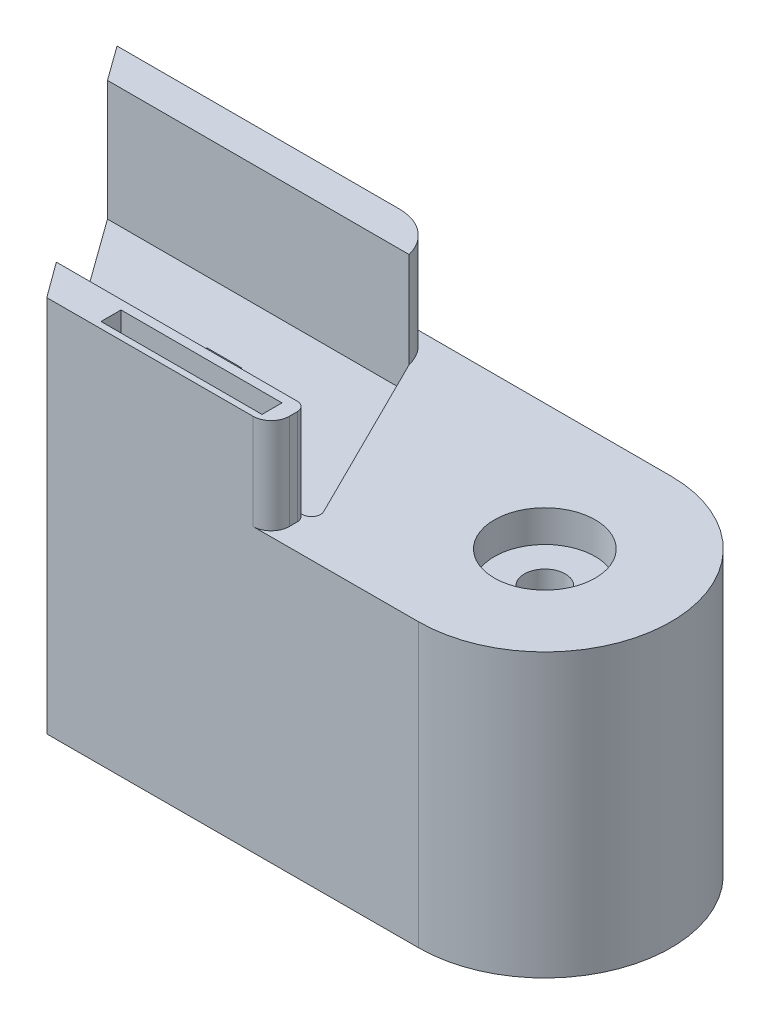
from build123d import *

# Parameters (mm, degrees)
EXTRUDE_1_DEPTH      = 83.1
SKETCH_2_W           = 35.4
SKETCH_2_H           = 4.4
SKETCH_2_W_2         = 30.4
CUT_EXTRUDE_1_DEPTH  = 5
SKETCH_3_W           = 35.4
SKETCH_3_H           = 4.4
CUT_EXTRUDE_2_DEPTH  = 5
CUT_EXTRUDE_4_DEPTH  = 21
SKETCH_7_R           = 4.5
CUT_EXTRUDE_5_DEPTH  = 107.120558328
SKETCH_8_R           = 11.1
CUT_EXTRUDE_6_DEPTH  = 7
SKETCH_9_R           = 11.15
CUT_EXTRUDE_7_DEPTH  = 7
CUT_EXTRUDE_8_DEPTH  = 107.120558328
FILLET_1_R           = 10
CUT_EXTRUDE_9_DEPTH  = 18.6
CUT_EXTRUDE_10_DEPTH = 5.42
FILLET_2_R           = 2
FILLET_3_R           = 2
FILLET_4_R           = 4


with BuildPart() as part:
    # Эскиз1 → Бобышка-Вытянуть1 (new body)
    with BuildSketch(Plane(origin=(0, 0, 0), x_dir=(1, 0, 0), z_dir=(0, 1, 0))):
        with BuildLine():
            Line((48.631682576, -27.49140627), (48.632387335, -27.491404976))
            ThreePointArc((48.632387335, -27.491404976), (76.382325871, 0.258533559), (48.632387335, 28.008472095))
            Line((48.632387335, 28.008472095), (-81.367612665, 28.008472095))
            Line((-81.367612665, 28.008472095), (-81.367612665, -27.730072458))
            Line((-81.367612665, -27.730072458), (48.631682576, -27.49140627))
        make_face()
    extrude(amount=EXTRUDE_1_DEPTH)

    # Эскиз2 → Вырез-Вытянуть1 (cut)
    with BuildSketch(Plane(origin=(0, 0, 0), x_dir=(-1, 0, 0), z_dir=(0, -1, 0))):
        with Locations((8.387612665, -21.628577297)):
            Rectangle(SKETCH_2_W, SKETCH_2_H)
        with Locations((45.887612665, 22.008472095)):
            Rectangle(SKETCH_2_W_2, SKETCH_2_H)
        with Locations((0.287612665, 22.008472095)):
            Rectangle(SKETCH_2_W_2, SKETCH_2_H)
    extrude(amount=-CUT_EXTRUDE_1_DEPTH, mode=Mode.SUBTRACT)

    # Эскиз3 → Вырез-Вытянуть2 (cut)
    with BuildSketch(Plane(origin=(0, 83.1, 0), x_dir=(1, 0, 0), z_dir=(0, 1, 0))):
        with Locations((-4.787612665, -24.021972088)):
            Rectangle(SKETCH_3_W, SKETCH_3_H)
    extrude(amount=-CUT_EXTRUDE_2_DEPTH, mode=Mode.SUBTRACT)

    # Эскиз6 → Вырез-Вытянуть4 (cut)
    with BuildSketch(Plane(origin=(0, 83.1, 0), x_dir=(1, 0, 0), z_dir=(0, 1, 0))):
        with BuildLine():
            Line((-38.710860793, -19.821972088), (16.267507788, -19.821972088))
            Line((16.267507788, -19.821972088), (16.267507788, -27.550823779))
            Line((16.267507788, -27.550823779), (37.284075999, -27.512239383))
            ThreePointArc((37.284075999, -27.512239383), (78.632374752, 0.286010542), (37.233224591, 28.008472095))
            Line((37.233224591, 28.008472095), (-1.367612665, 28.008472095))
            Line((-1.367612665, 28.008472095), (-1.367612665, 20.408472095))
            Line((-1.367612665, 20.408472095), (-67.700309337, 20.408472095))
            Line((-67.700309337, 20.408472095), (-73.189452249, 28.008472095))
            Line((-73.189452249, 28.008472095), (-81.367612665, 28.008472095))
            Line((-81.367612665, 28.008472095), (-81.367612665, -27.730072458))
            Line((-81.367612665, -27.730072458), (-32.996113938, -27.641267044))
            Line((-32.996113938, -27.641267044), (-38.710860793, -19.821972088))
        make_face()
    extrude(amount=-CUT_EXTRUDE_4_DEPTH, mode=Mode.SUBTRACT)

    # Эскиз7 → Вырез-Вытянуть5 (cut, through all)
    with BuildSketch(Plane(origin=(0, 62.1, 0), x_dir=(1, 0, 0), z_dir=(0, 1, 0))):
        with Locations(Location((48.632387335, 0.258533559, 0), (0, 0, 270))):
            Circle(SKETCH_7_R)
    extrude(amount=-CUT_EXTRUDE_5_DEPTH, mode=Mode.SUBTRACT)

    # Эскиз8 → Вырез-Вытянуть6 (cut)
    with BuildSketch(Plane(origin=(0, 62.1, 0), x_dir=(1, 0, 0), z_dir=(0, 1, 0))):
        with Locations(Location((48.632387335, 0.258533559, 0), (0, 0, 270))):
            Circle(SKETCH_8_R)
    extrude(amount=-CUT_EXTRUDE_6_DEPTH, mode=Mode.SUBTRACT)

    # Эскиз9 → Вырез-Вытянуть7 (cut)
    with BuildSketch(Plane.XZ):
        with Locations(Location((48.632387335, -0.258533559, 0), (0, 0, 270))):
            Circle(SKETCH_9_R)
    extrude(amount=-CUT_EXTRUDE_7_DEPTH, mode=Mode.SUBTRACT)

    # Эскиз10 → Вырез-Вытянуть8 (cut, through all)
    with BuildSketch(Plane(origin=(0, 62.1, 0), x_dir=(1, 0, 0), z_dir=(0, 1, 0))):
        Polygon((-73.189452249, 28.008472095), (-81.367612665, 28.008472095), (-81.367612665, -27.730072458), (-32.996113938, -27.641267044), align=None)
    extrude(amount=-CUT_EXTRUDE_8_DEPTH, mode=Mode.SUBTRACT)

    # Скругление1
    # the kernel refuses this fillet: 10 mm, written as the material it takes off along each edge
    with BuildSketch(Plane(origin=(-1.367612665, 107.369322199, -28.008472095), x_dir=(0, 0, 1), z_dir=(0, -1, 0))) as fillet_1_piece_1:
        with BuildLine():
            CenterArc((10, 9.70772888), FILLET_1_R, 180, 76.113459637)
            Line((0, 9.70772888), (-0.2, 9.70772888))
            Line((-0.2, 9.70772888), (-0.2, 0))
            Line((-0.2, 0), (0, -0.2))
            ThreePointArc((0, -0.2), (3.8, -0.2), (7.552, -0.194154578))
            Line((7.552, -0.194154578), (7.6, 0))
        make_face()
    extrude(amount=45.269322199, mode=Mode.SUBTRACT)

    # Эскиз11 → Вырез-Вытянуть9 (cut)
    with BuildSketch(Plane(origin=(0, 62.1, 0), x_dir=(1, 0, 0), z_dir=(0, 1, 0))):
        Polygon((-35.9280852, 0.295824639), (-32.155315119, -6.243954097), (-24.605315558, -6.246528733), (-20.828086078, 0.290675368), (-24.600856158, 6.830454104), (-32.150855719, 6.833028739), align=None)
    extrude(amount=-CUT_EXTRUDE_9_DEPTH, mode=Mode.SUBTRACT)

    # Эскиз12 → Вырез-Вытянуть10 (cut)
    with BuildSketch(Plane(origin=(0, 62.1, 0), x_dir=(1, 0, 0), z_dir=(0, 1, 0))):
        Polygon((-1.367612665, 20.408472095), (18.632387335, -19.821972088), (-38.710860793, -19.821972088), (-67.700309337, 20.408472095), align=None)
    extrude(amount=-CUT_EXTRUDE_10_DEPTH, mode=Mode.SUBTRACT)

    # Скругление2
    fillet_2_edges = [part.edges().sort_by_distance(p)[0] for p in [
        (18.632387335, 59.39, 19.821972088),
    ]]
    fillet(fillet_2_edges, radius=FILLET_2_R)

    # Скругление3
    # the kernel refuses this fillet: 2 mm, written as the material it takes off along each edge
    with BuildSketch(Plane(origin=(16.267507788, 88.589321146, 19.62624363), x_dir=(-0.9952454215977946, 0, 0.09739892601373129), z_dir=(0, -1, 0))) as fillet_3_piece_1:
        with BuildLine():
            CenterArc((2.204352437, -1.990490843), FILLET_3_R, 95.589408628, 90)
            Line((0.213861594, -2.185288695), (0.014812509, -2.20476848))
            Line((0.014812509, -2.20476848), (-0.199049084, -0.019479785))
            Line((-0.199049084, -0.019479785), (0.068306766, 0.187973896))
            ThreePointArc((0.068306766, 0.187973896), (0.858385725, 0.088297205), (1.9900748, 0.199049084))
            Line((1.9900748, 0.199049084), (2.009554585, 0))
        make_face()
    extrude(amount=26.489321146, mode=Mode.SUBTRACT)

    # Скругление4
    fillet_4_edges = [part.edges().sort_by_distance(p)[0] for p in [
        (16.267507788, 72.6, 27.550823779),
    ]]
    fillet(fillet_4_edges, radius=FILLET_4_R)


solid = part.part
